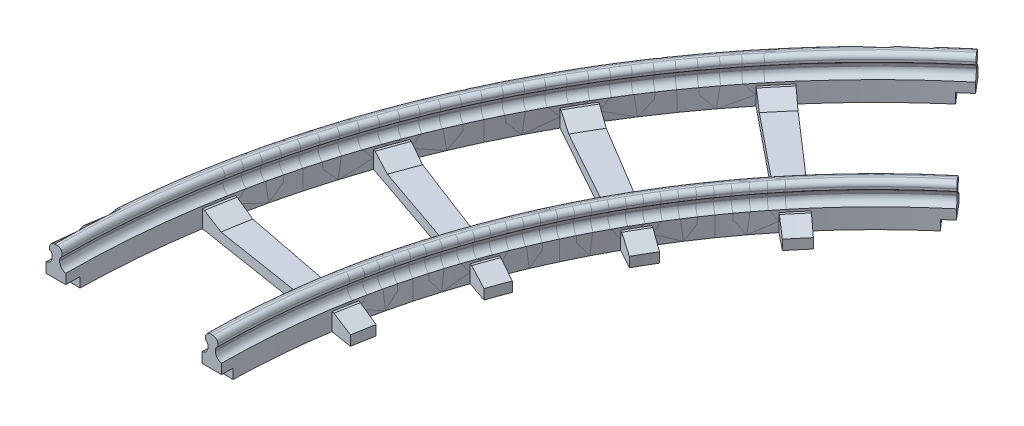
from build123d import *

# Parameters (mm, degrees)
REVOLVE_1_ANGLE          = 10
FILLET_1_R               = 1.5
FILLET_2_R               = 1.5
FILLET_3_R               = 1
FILLET_4_R               = 1
SKETCH_7_W               = 4
SKETCH_7_H               = 2
CUT_REVOLVE_1_ANGLE      = 1
SKETCH_10_R              = 0.4
CUT_EXTRUDE_1_DEPTH      = 2
REVOLVE_2_ANGLE          = 1
PATTERN_CIRCULAR_1_COUNT = 4
PATTERN_CIRCULAR_1_ANGLE = 30


with BuildPart() as part:
    # 草图4 → 旋转1 (revolve)
    with BuildSketch(Plane.XY):
        Polygon((0.75, -1.5), (1.25, -1.5), (1.25, 0), (0, 0), (-1.25, 0), (-1.25, -1.5), (-0.75, -1.5), (-0.75, -4), (-2, -4), (-2, -8), (0, -8), (2, -8), (2, -4), (0.75, -4), align=None)
        Polygon((31.5, 0), (32.75, 0), (32.75, -1.5), (32.25, -1.5), (32.25, -4), (33.5, -4), (33.5, -8), (31.5, -8), (29.5, -8), (29.5, -4), (30.75, -4), (30.75, -1.5), (30.25, -1.5), (30.25, 0), align=None)
    revolve(axis=Axis((165.75, 3.853460973, 0), (0, -1, 0)), revolution_arc=REVOLVE_1_ANGLE)

    # 圆角1
    # the kernel refuses this fillet: 1.5 mm, written as the material it adds along each edge
    with BuildSketch(Plane(origin=(165.75, -4, 0), x_dir=(-1, 0, 0), z_dir=(0, 0, 1))) as fillet_1_piece_1:
        with BuildLine():
            CenterArc((163.5, -1.479019946), FILLET_1_R, 0, 80.405931773)
            Line((165, -1.479019946), (165.03, -1.479019946))
            Line((165.03, -1.479019946), (165.03, 0))
            Line((165.03, 0), (165, 0.03))
            ThreePointArc((165, 0.03), (164.375, 0.03), (163.755, 0.029580399))
            Line((163.755, 0.029580399), (163.75, 0))
        make_face()
    revolve(axis=Axis((165.75, -4, 0), (0, -1, 0)), revolution_arc=10)
    with BuildSketch(Plane(origin=(165.75, -4, 0), x_dir=(-1, 0, 0), z_dir=(0, 0, 1))) as fillet_1_piece_2:
        with BuildLine():
            CenterArc((168, -1.479019946), FILLET_1_R, 99.594068227, 80.405931773)
            Line((166.5, -1.479019946), (166.47, -1.479019946))
            Line((166.47, -1.479019946), (166.47, 0))
            Line((166.47, 0), (166.5, 0.03))
            ThreePointArc((166.5, 0.03), (167.125, 0.03), (167.745, 0.029580399))
            Line((167.745, 0.029580399), (167.75, 0))
        make_face()
    revolve(axis=Axis((165.75, -4, 0), (0, -1, 0)), revolution_arc=10)

    # 圆角2
    # the kernel refuses this fillet: 1.5 mm, written as the material it adds along each edge
    with BuildSketch(Plane(origin=(165.75, -4, 0), x_dir=(-1, 0, 0), z_dir=(0, 0, 1))) as fillet_2_piece_1:
        with BuildLine():
            CenterArc((136.5, -1.479019946), FILLET_2_R, 99.594068227, 80.405931773)
            Line((136.25, 0), (136.245, 0.029580399))
            ThreePointArc((136.245, 0.029580399), (135.625, 0.03), (135, 0.03))
            Line((135, 0.03), (134.97, 0))
            Line((134.97, 0), (134.97, -1.479019946))
            Line((134.97, -1.479019946), (135, -1.479019946))
        make_face()
    revolve(axis=Axis((165.75, -4, 0), (0, -1, 0)), revolution_arc=10)
    with BuildSketch(Plane(origin=(165.75, -4, 0), x_dir=(-1, 0, 0), z_dir=(0, 0, 1))) as fillet_2_piece_2:
        with BuildLine():
            CenterArc((132, -1.479019946), FILLET_2_R, 0, 80.405931773)
            Line((133.5, -1.479019946), (133.53, -1.479019946))
            Line((133.53, -1.479019946), (133.53, 0))
            Line((133.53, 0), (133.5, 0.03))
            ThreePointArc((133.5, 0.03), (132.875, 0.03), (132.255, 0.029580399))
            Line((132.255, 0.029580399), (132.25, 0))
        make_face()
    revolve(axis=Axis((165.75, -4, 0), (0, -1, 0)), revolution_arc=10)

    # 圆角3
    # the kernel refuses this fillet: 1 mm, written as the material it adds along each edge
    with BuildSketch(Plane(origin=(165.75, -1.5, 0), x_dir=(-1, 0, 0), z_dir=(0, 0, 1))) as fillet_3_piece_1:
        with BuildLine():
            CenterArc((136, 0.866025404), FILLET_3_R, 180, 60)
            Line((135, 0.866025404), (135, 0))
            Line((135, 0), (135.5, 0))
        make_face()
    revolve(axis=Axis((165.75, -1.5, 0), (0, -1, 0)), revolution_arc=10)
    with BuildSketch(Plane(origin=(165.75, -1.5, 0), x_dir=(-1, 0, 0), z_dir=(0, 0, 1))) as fillet_3_piece_2:
        with BuildLine():
            CenterArc((132.5, 0.866025404), FILLET_3_R, 300, 60)
            Line((133, 0), (133.5, 0))
            Line((133.5, 0), (133.5, 0.866025404))
        make_face()
    revolve(axis=Axis((165.75, -1.5, 0), (0, -1, 0)), revolution_arc=10)
    # the kernel refuses this fillet: 1 mm, written as the material it takes off along each edge
    with BuildSketch(Plane(origin=(165.75, 0, 0), x_dir=(-0.9998233399867428, 0, 0.018795978765534377), z_dir=(0.018795978765534377, 0, 0.9998233399867428))) as fillet_3_2_piece_1:
        with BuildLine():
            CenterArc((133 + FILLET_3_R, FILLET_3_R), FILLET_3_R, 180, 90)
            Line((133, FILLET_3_R), (133, 0))
            Line((133, 0), (133 + FILLET_3_R, 0))
        make_face()
    revolve(axis=Axis((165.75, 0, 0), (0, -1, 0)), revolution_arc=12.153987353, mode=Mode.SUBTRACT)
    with BuildSketch(Plane(origin=(165.75, 0, 0), x_dir=(-0.9998297984864879, 0, 0.01844922921070363), z_dir=(0.01844922921070363, 0, 0.9998297984864879))) as fillet_3_2_piece_2:
        with BuildLine():
            CenterArc((135.5 - FILLET_3_R, FILLET_3_R), FILLET_3_R, 270, 90)
            Line((135.5 - FILLET_3_R, 0), (135.5, 0))
            Line((135.5, 0), (135.5, FILLET_3_R))
        make_face()
    revolve(axis=Axis((165.75, 0, 0), (0, -1, 0)), revolution_arc=12.114245889, mode=Mode.SUBTRACT)

    # 圆角4
    # the kernel refuses this fillet: 1 mm, written as the material it adds along each edge
    with BuildSketch(Plane(origin=(165.75, -1.5, 0), x_dir=(-1, 0, 0), z_dir=(0, 0, 1))) as fillet_4_piece_1:
        with BuildLine():
            CenterArc((167.5, 0.866025404), FILLET_4_R, 180, 60)
            Line((167, 0), (166.5, 0))
            Line((166.5, 0), (166.5, 0.866025404))
        make_face()
    revolve(axis=Axis((165.75, -1.5, 0), (0, -1, 0)), revolution_arc=10)
    with BuildSketch(Plane(origin=(165.75, -1.5, 0), x_dir=(-1, 0, 0), z_dir=(0, 0, 1))) as fillet_4_piece_2:
        with BuildLine():
            CenterArc((164, 0.866025404), FILLET_4_R, 300, 60)
            Line((164.5, 0), (165, 0))
            Line((165, 0), (165, 0.866025404))
        make_face()
    revolve(axis=Axis((165.75, -1.5, 0), (0, -1, 0)), revolution_arc=10)
    # the kernel refuses this fillet: 1 mm, written as the material it takes off along each edge
    with BuildSketch(Plane(origin=(165.75, 0, 0), x_dir=(-0.9998845180351503, 0, 0.015197058715919934), z_dir=(0.015197058715919934, 0, 0.9998845180351503))) as fillet_4_2_piece_1:
        with BuildLine():
            CenterArc((164.5 + FILLET_4_R, FILLET_4_R), FILLET_4_R, 180, 90)
            Line((164.5, FILLET_4_R), (164.5, 0))
            Line((164.5, 0), (164.5 + FILLET_4_R, 0))
        make_face()
    revolve(axis=Axis((165.75, 0, 0), (0, -1, 0)), revolution_arc=11.74152169, mode=Mode.SUBTRACT)
    with BuildSketch(Plane(origin=(165.75, 0, 0), x_dir=(-0.9998879496351009, 0, 0.014969574961036002), z_dir=(0.014969574961036002, 0, 0.9998879496351009))) as fillet_4_2_piece_2:
        with BuildLine():
            CenterArc((167 - FILLET_4_R, FILLET_4_R), FILLET_4_R, 270, 90)
            Line((167 - FILLET_4_R, 0), (167, 0))
            Line((167, 0), (167, FILLET_4_R))
        make_face()
    revolve(axis=Axis((165.75, 0, 0), (0, -1, 0)), revolution_arc=11.715451006, mode=Mode.SUBTRACT)

    # 草图7 → 切除-旋转1 (revolve, cut)
    with BuildSketch(Plane.XY):
        with Locations((0, -7)):
            Rectangle(SKETCH_7_W, SKETCH_7_H)
        with Locations((31.5, -7)):
            Rectangle(SKETCH_7_W, SKETCH_7_H)
    revolve(axis=Axis((165.75, 3.853460973, 0), (0, -1, 0)), revolution_arc=CUT_REVOLVE_1_ANGLE, mode=Mode.SUBTRACT)

    # 草图10 → 切除-拉伸1 (cut)
    with BuildSketch(Plane.XZ.offset(6)):
        with Locations(Location((0.006311252, -1.446423259, 0), (0, 0, 270))):
            Circle(SKETCH_10_R)
        with Locations(Location((31.505111829, -1.171537391, 0), (0, 0, 270))):
            Circle(SKETCH_10_R)
    extrude(amount=-CUT_EXTRUDE_1_DEPTH, mode=Mode.SUBTRACT)

    # 草图11 → 旋转2 (revolve)
    with BuildSketch(Plane(origin=(4.997974052, 0, -28.344919378), x_dir=(-0.9848077530122081, 0, -0.17364817766693072), z_dir=(0.17364817766693072, 0, -0.9848077530122081))):
        Polygon((-26.981885062, -4.5), (-26.481885062, -4.5), (-22.481885062, -6), (-3.981885062, -6), (0.018114938, -4.5), (0.518114938, -4.5), (4.518114938, -4.5), (5.018114938, -4.5), (9.018114938, -6), (9.018114938, -8), (4.518114938, -8), (0.518114938, -8), (-26.981885062, -8), (-30.981885062, -8), (-35.481885062, -8), (-35.481885062, -6), (-31.481885062, -4.5), (-30.981885062, -4.5), align=None)
    revolve(axis=Axis((165.75, 3.853460973, 0), (0, 1, 0)), revolution_arc=REVOLVE_2_ANGLE)

    # 镜向1: part across face


with BuildPart() as part_1:
    add(part.part)
    add(part.part.mirror(Plane(origin=(18.028837048, -5.996688627, -26.04722665), x_dir=(0.9848077529548817, 0, 0.17364817799204443), z_dir=(0.17364817799204443, 0, -0.9848077529548818))))


with BuildPart() as pattern_circular_1_1:
    # 阵列(圆周)1: pattern copy
    add(part_1.part.rotate(Axis((165.75, 0, 0), (0, -1, 0)), 1 * PATTERN_CIRCULAR_1_ANGLE / (PATTERN_CIRCULAR_1_COUNT - 1)))


with BuildPart() as pattern_circular_1_2:
    # 阵列(圆周)1: pattern copy
    add(part_1.part.rotate(Axis((165.75, 0, 0), (0, -1, 0)), 2 * PATTERN_CIRCULAR_1_ANGLE / (PATTERN_CIRCULAR_1_COUNT - 1)))


with BuildPart() as pattern_circular_1_3:
    # 阵列(圆周)1: pattern copy
    add(part_1.part.rotate(Axis((165.75, 0, 0), (0, -1, 0)), 3 * PATTERN_CIRCULAR_1_ANGLE / (PATTERN_CIRCULAR_1_COUNT - 1)))


solid = Compound([part_1.part, pattern_circular_1_1.part, pattern_circular_1_2.part, pattern_circular_1_3.part])
